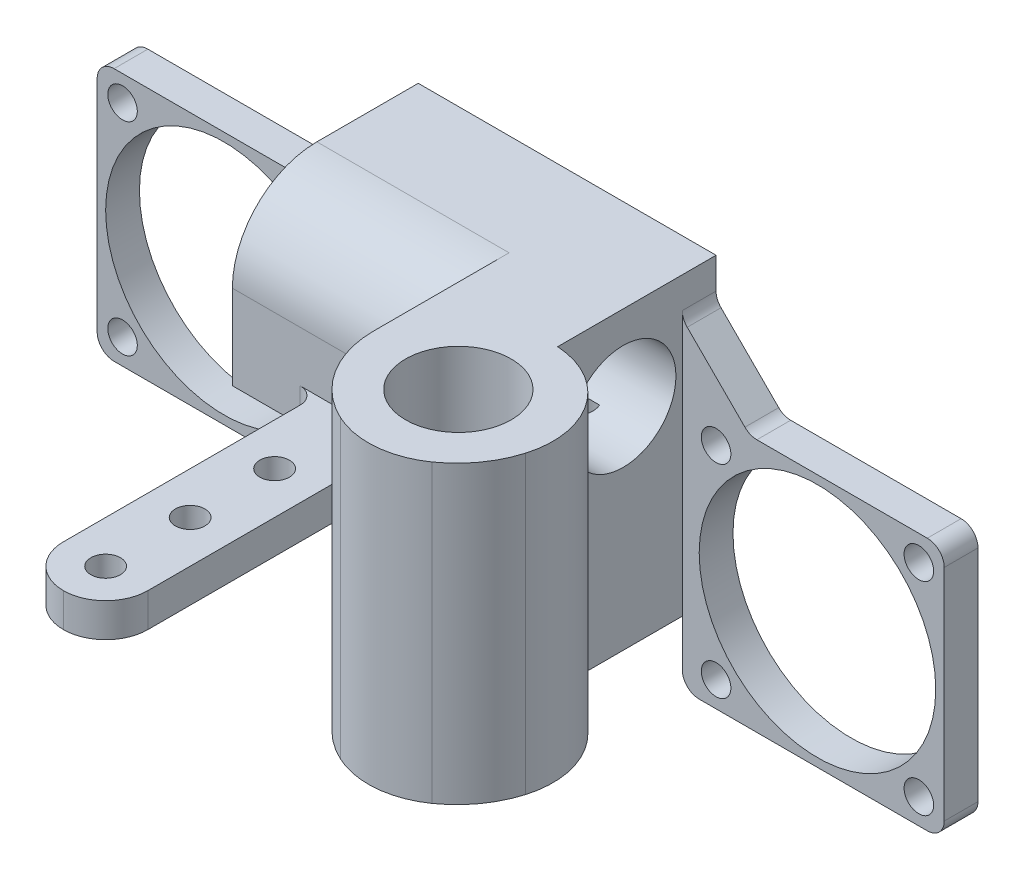
from build123d import *

# Parameters (mm, degrees)
EXTRUDE_1_DEPTH                  = 35
SKETCH_2_W                       = 22
SKETCH_2_H                       = 35
EXTRUDE_2_DEPTH                  = 22.75
SKETCH_3_W                       = 11
SKETCH_3_H                       = 15
CUT_EXTRUDE_1_DEPTH              = 32
HOLE_WIZARD_12_5_12_5_1_D        = 12.5
HOLE_WIZARD_12_5_12_5_2_D        = 12.5
HOLE_WIZARD_3_5_3_5_1_D          = 3.5
HOLE_WIZARD_3_5_3_5_1_DEPTH      = 5
SKETCH_10_W                      = 9.5
SKETCH_10_H                      = 18.75
CUT_EXTRUDE_2_DEPTH              = 64.639610362
SKETCH_11_W                      = 22.75
SKETCH_11_H                      = 11
CUT_EXTRUDE_3_DEPTH              = 15
FILLET_2_R                       = 10
SKETCH_13_W                      = 4
SKETCH_13_H                      = 30
EXTRUDE_3_DEPTH                  = 31
SKETCH_16_W                      = 1.75
SKETCH_16_H                      = 4
HOLE_WIZARD_3_5_3_5_2_AT_2_COUNT = 2
HOLE_WIZARD_3_5_3_5_2_AT_2_PITCH = 24
HOLE_WIZARD_3_5_3_5_2_AT_3_COUNT = 2
HOLE_WIZARD_3_5_3_5_2_AT_3_PITCH = 33.941125497
HOLE_WIZARD_3_5_3_5_2_AT_4_COUNT = 2
HOLE_WIZARD_3_5_3_5_2_AT_4_PITCH = 24
SKETCH_17_R                      = 14
CUT_EXTRUDE_4_DEPTH              = 76.494728698
SKETCH_19_W                      = 4
SKETCH_19_H                      = 30
EXTRUDE_5_DEPTH                  = 34
SKETCH_20_R                      = 14
CUT_EXTRUDE_5_DEPTH              = 76.494728698
SKETCH_22_W                      = 1.75
SKETCH_22_H                      = 4
HOLE_WIZARD_3_5_3_5_3_AT_2_COUNT = 2
HOLE_WIZARD_3_5_3_5_3_AT_2_PITCH = 24
HOLE_WIZARD_3_5_3_5_3_AT_3_COUNT = 2
HOLE_WIZARD_3_5_3_5_3_AT_3_PITCH = 33.941125497
HOLE_WIZARD_3_5_3_5_3_AT_4_COUNT = 2
HOLE_WIZARD_3_5_3_5_3_AT_4_PITCH = 24
EXTRUDE_6_DEPTH                  = 4
EXTRUDE_7_DEPTH                  = 4
SKETCH_26_W                      = 10
SKETCH_26_H                      = 4
EXTRUDE_8_DEPTH                  = 35
HOLE_WIZARD_3_5_3_5_4_D          = 3.5
FILLET_7_R                       = 2
FILLET_9_R                       = 5
FILLET_10_R                      = 10
FILLET_12_R                      = 10
FILLET_13_R                      = 2
FILLET_14_R                      = 2
CUT_EXTRUDE_6_DEPTH              = 86.007352664
CUT_EXTRUDE_7_DEPTH              = 15
FILLET_15_R                      = 10


# Some blends are built 0.0001 mm under size
with BuildPart() as part:
    # Эскиз1 → Бобышка-Вытянуть1 (new body)
    with BuildSketch(Plane(origin=(0, 35, 0), x_dir=(1, 0, 0), z_dir=(0, 1, 0))):
        with BuildLine():
            Line((35, 0), (13, 0))
            Line((13, 0), (13, -28))
            ThreePointArc((13, -28), (16.514718626, -36.485281374), (25, -40))
            ThreePointArc((25, -40), (32.16515139, -35.913807126), (35, -28.167840434))
            Line((35, -28.167840434), (35, 0))
        make_face()
    extrude(amount=-EXTRUDE_1_DEPTH)

    # Эскиз2 → Бобышка-Вытянуть2 (add)
    with BuildSketch(Plane.ZY.offset(-13)):
        with Locations((11, 17.5)):
            Rectangle(SKETCH_2_W, SKETCH_2_H)
    extrude(amount=EXTRUDE_2_DEPTH)

    # Эскиз3 → Вырез-Вытянуть1 (cut)
    with BuildSketch(Plane.ZY.offset(9.75)):
        with Locations((5.5, 7.5)):
            Rectangle(SKETCH_3_W, SKETCH_3_H)
    extrude(amount=-CUT_EXTRUDE_1_DEPTH, mode=Mode.SUBTRACT)

    # Диаметр отверстия Ø12.5 (12.5)1 (through all)
    with Locations(Plane(origin=(0, 35, 0), x_dir=(1, 0, 0), z_dir=(0, 1, 0))):
        with Locations((24, -29)):
            Hole(HOLE_WIZARD_12_5_12_5_1_D / 2)

    # Диаметр отверстия Ø12.5 (12.5)2 (through all)
    with Locations(Plane(origin=(35, 0, 0), x_dir=(0, 0, -1), z_dir=(1, 0, 0))):
        with Locations((-11, 25)):
            Hole(HOLE_WIZARD_12_5_12_5_2_D / 2)

    # Диаметр отверстия Ø3.5 (3.5)1
    with Locations(Plane(origin=(0, 15, 0), x_dir=(-1, 0, 0), z_dir=(0, -1, 0))):
        with Locations((-17.25, -7), (6.75, -7), (-12.25, -7), (1.75, -7)):
            Hole(HOLE_WIZARD_3_5_3_5_1_D / 2, depth=HOLE_WIZARD_3_5_3_5_1_DEPTH)

    # Эскиз10 → Вырез-Вытянуть2 (cut, through all)
    with BuildSketch(Plane.XZ):
        with Locations((30.25, 9.375)):
            Rectangle(SKETCH_10_W, SKETCH_10_H)
    extrude(amount=-CUT_EXTRUDE_2_DEPTH, mode=Mode.SUBTRACT)

    # Эскиз11 → Вырез-Вытянуть3 (cut)
    with BuildSketch(Plane.XZ):
        with Locations((1.625, 16.5)):
            Rectangle(SKETCH_11_W, SKETCH_11_H)
    extrude(amount=-CUT_EXTRUDE_3_DEPTH, mode=Mode.SUBTRACT)

    # Скругление2
    fillet_2_edges = [part.edges().sort_by_distance(p)[0] for p in [
        (25, 17.5, 40),
    ]]
    fillet(fillet_2_edges, radius=FILLET_2_R)

    # Эскиз19 → Бобышка-Вытянуть5 (add)
    with BuildSketch(Plane.ZY.offset(9.75)):
        with Locations((2, 7.5)):
            Rectangle(SKETCH_19_W, SKETCH_19_H)
    extrude(amount=EXTRUDE_5_DEPTH)

    # Эскиз20 → Вырез-Вытянуть5 (cut, through all)
    with BuildSketch(Plane.XY.offset(4)):
        with Locations((-28.75, 7.5)):
            Circle(SKETCH_20_R)
    extrude(amount=-CUT_EXTRUDE_5_DEPTH, mode=Mode.SUBTRACT)

    # Эскиз22 → Диаметр отверстия Ø3.5 (3.5)3 (revolve, cut)
    with BuildSketch(Plane(origin=(-16.75, 19.5, 4), x_dir=(0, -1, 0), z_dir=(1, 0, 0))):
        with Locations((0.875, 2)):
            Rectangle(SKETCH_22_W, SKETCH_22_H)
    hole_wizard_3_5_3_5_3 = revolve(axis=Axis((-16.75, 19.5, 10.35), (0, 0, -1)), mode=Mode.SUBTRACT)

    # Диаметр отверстия Ø3.5 (3.5)3 at 2: Диаметр отверстия Ø3.5 (3.5)3 ×2
    with Locations(*[(0, -i * HOLE_WIZARD_3_5_3_5_3_AT_2_PITCH, 0) for i in range(1, HOLE_WIZARD_3_5_3_5_3_AT_2_COUNT)]):
        add(hole_wizard_3_5_3_5_3, mode=Mode.SUBTRACT)

    # Диаметр отверстия Ø3.5 (3.5)3 at 3: Диаметр отверстия Ø3.5 (3.5)3 ×2
    with Locations(*[Vector(-0.7071067811865475, -0.7071067811865476, 0) * (i * HOLE_WIZARD_3_5_3_5_3_AT_3_PITCH) for i in range(1, HOLE_WIZARD_3_5_3_5_3_AT_3_COUNT)]):
        add(hole_wizard_3_5_3_5_3, mode=Mode.SUBTRACT)

    # Диаметр отверстия Ø3.5 (3.5)3 at 4: Диаметр отверстия Ø3.5 (3.5)3 ×2
    with Locations(*[(-i * HOLE_WIZARD_3_5_3_5_3_AT_4_PITCH, 0, 0) for i in range(1, HOLE_WIZARD_3_5_3_5_3_AT_4_COUNT)]):
        add(hole_wizard_3_5_3_5_3, mode=Mode.SUBTRACT)

    # Эскиз24 → Бобышка-Вытянуть6 (add)
    with BuildSketch(Plane.XY.offset(4)):
        Polygon((-9.75, 30.5), (-17.75, 22.5), (-9.75, 22.5), align=None)
    extrude(amount=-EXTRUDE_6_DEPTH)



with BuildPart() as body_2:
    # Эскиз13 → Бобышка-Вытянуть3 (new body)
    with BuildSketch(Plane(origin=(25.5, 0, 0), x_dir=(0, 0, -1), z_dir=(1, 0, 0))):
        with Locations((-2, 7.5)):
            Rectangle(SKETCH_13_W, SKETCH_13_H)
    extrude(amount=EXTRUDE_3_DEPTH)

    # Эскиз16 → Диаметр отверстия Ø3.5 (3.5)2 (revolve, cut)
    with BuildSketch(Plane(origin=(29.5, -4.5, 4), x_dir=(0, -1, 0), z_dir=(1, 0, 0))):
        with Locations((0.875, 2)):
            Rectangle(SKETCH_16_W, SKETCH_16_H)
    hole_wizard_3_5_3_5_2 = revolve(axis=Axis((29.5, -4.5, 10.35), (0, 0, -1)), mode=Mode.SUBTRACT)

    # Диаметр отверстия Ø3.5 (3.5)2 at 2: Диаметр отверстия Ø3.5 (3.5)2 ×2
    with Locations(*[(0, i * HOLE_WIZARD_3_5_3_5_2_AT_2_PITCH, 0) for i in range(1, HOLE_WIZARD_3_5_3_5_2_AT_2_COUNT)]):
        add(hole_wizard_3_5_3_5_2, mode=Mode.SUBTRACT)

    # Диаметр отверстия Ø3.5 (3.5)2 at 3: Диаметр отверстия Ø3.5 (3.5)2 ×2
    with Locations(*[Vector(0.7071067811865475, 0.7071067811865476, 0) * (i * HOLE_WIZARD_3_5_3_5_2_AT_3_PITCH) for i in range(1, HOLE_WIZARD_3_5_3_5_2_AT_3_COUNT)]):
        add(hole_wizard_3_5_3_5_2, mode=Mode.SUBTRACT)

    # Диаметр отверстия Ø3.5 (3.5)2 at 4: Диаметр отверстия Ø3.5 (3.5)2 ×2
    with Locations(*[(i * HOLE_WIZARD_3_5_3_5_2_AT_4_PITCH, 0, 0) for i in range(1, HOLE_WIZARD_3_5_3_5_2_AT_4_COUNT)]):
        add(hole_wizard_3_5_3_5_2, mode=Mode.SUBTRACT)

    # Эскиз17 → Вырез-Вытянуть4 (cut, through all)
    with BuildSketch(Plane.XY.offset(4)):
        with Locations((41.5, 7.5)):
            Circle(SKETCH_17_R)
    extrude(amount=-CUT_EXTRUDE_4_DEPTH, mode=Mode.SUBTRACT)


with BuildPart() as part_1:
    add(part.part)

    add(body_2.part)  # Бобышка-Вытянуть7 merges body 2
    # Эскиз25 → Бобышка-Вытянуть7 (add)
    with BuildSketch(Plane.XY.offset(4)):
        Polygon((33.5, 22.5), (25.5, 30.5), (25.5, 22.5), align=None)
    extrude(amount=-EXTRUDE_7_DEPTH)

    # Эскиз26 → Бобышка-Вытянуть8 (add)
    with BuildSketch(Plane.XY.offset(22)):
        with Locations((5.25, 17)):
            Rectangle(SKETCH_26_W, SKETCH_26_H)
    extrude(amount=EXTRUDE_8_DEPTH)

    # Диаметр отверстия Ø3.5 (3.5)4 (through all)
    with Locations(Plane(origin=(0, 15, 0), x_dir=(-1, 0, 0), z_dir=(0, -1, 0))):
        with Locations((-5.25, -52), (-5.25, -42), (-5.25, -32)):
            Hole(HOLE_WIZARD_3_5_3_5_4_D / 2)

    # Скругление7
    fillet_7_edges = [part_1.edges().sort_by_distance(p)[0] for p in [
        (0.25, 17, 22),
        (10.25, 17, 22),
    ]]
    fillet(fillet_7_edges, radius=FILLET_7_R)

    # Скругление9
    fillet_9_edges = [part_1.edges().sort_by_distance(p)[0] for p in [
        (0.25, 17, 57),
        (10.25, 17, 57),
    ]]
    fillet(fillet_9_edges, radius=FILLET_9_R - 0.0001)  # a hair under: the kernel refuses the full size

    # Скругление10
    # the kernel refuses this fillet: 10 mm, written as the material it takes off along each edge
    with BuildSketch(Plane(origin=(35, -32.046488893, 18.75), x_dir=(-0.03816406367220006, 0, 0.999271486756239), z_dir=(0, 1, 0))) as fillet_10_piece_1:
        with BuildLine():
            CenterArc((10.360556073, -9.693195649), FILLET_10_R, 75.770650452, 103.082689776)
            Line((0.362558605, -9.493079124), (-0.637241142, -9.473067472))
            ThreePointArc((-0.637241142, -9.473067472), (-0.817992184, -4.784703626), (-0.999271487, -0.038164064))
            Line((-0.999271487, -0.038164064), (-0.038164064, 0.999271487))
            ThreePointArc((-0.038164064, 0.999271487), (9.372815349, 1.358694549), (13.064399506, 0.969319565))
            Line((13.064399506, 0.969319565), (12.818595557, 0))
        make_face()
    extrude(amount=99.092977786, mode=Mode.SUBTRACT)

    # Скругление12
    fillet_12_edges = [part_1.edges().sort_by_distance(p)[0] for p in [
        (1.625, 35, 22),
    ]]
    fillet(fillet_12_edges, radius=FILLET_12_R)

    # Скругление13
    fillet_13_edges = [part_1.edges().sort_by_distance(p)[0] for p in [
        (-9.75, 30.5, 2),
        (-9.75, -7.5, 2),
        (-43.75, 22.5, 2),
        (-43.75, -7.5, 2),
        (-17.75, 22.5, 2),
    ]]
    fillet(fillet_13_edges, radius=FILLET_13_R)

    # Скругление14
    fillet_14_edges = [part_1.edges().sort_by_distance(p)[0] for p in [
        (56.5, 22.5, 2),
        (25.5, 30.5, 2),
        (33.5, 22.5, 2),
        (25.5, -7.5, 2),
        (56.5, -7.5, 2),
    ]]
    fillet(fillet_14_edges, radius=FILLET_14_R)

    # Эскиз32 → Вырез-Вытянуть6 (cut, through all)
    with BuildSketch(Plane.XY.offset(4)):
        with BuildLine():
            Line((-9.75, 2.270340952), (-9.75, 15))
            ThreePointArc((-9.75, 15), (-10.952290213, 8.635170476), (-9.75, 2.270340952))
        make_face()
    extrude(amount=-CUT_EXTRUDE_6_DEPTH, mode=Mode.SUBTRACT)

    # Эскиз33 → Вырез-Вытянуть7 (cut)
    with BuildSketch(Plane.XZ):
        with BuildLine():
            Line((13, 22), (13, 11))
            Line((13, 11), (22.25, 11))
            ThreePointArc((22.25, 11), (19.219835157, 17.841111382), (13, 22))
        make_face()
    extrude(amount=-CUT_EXTRUDE_7_DEPTH, mode=Mode.SUBTRACT)

    # Скругление15
    fillet_15_edges = [part_1.edges().sort_by_distance(p)[0] for p in [
        (13, 7.5, 22),
    ]]
    fillet(fillet_15_edges, radius=FILLET_15_R)


solid = part_1.part
